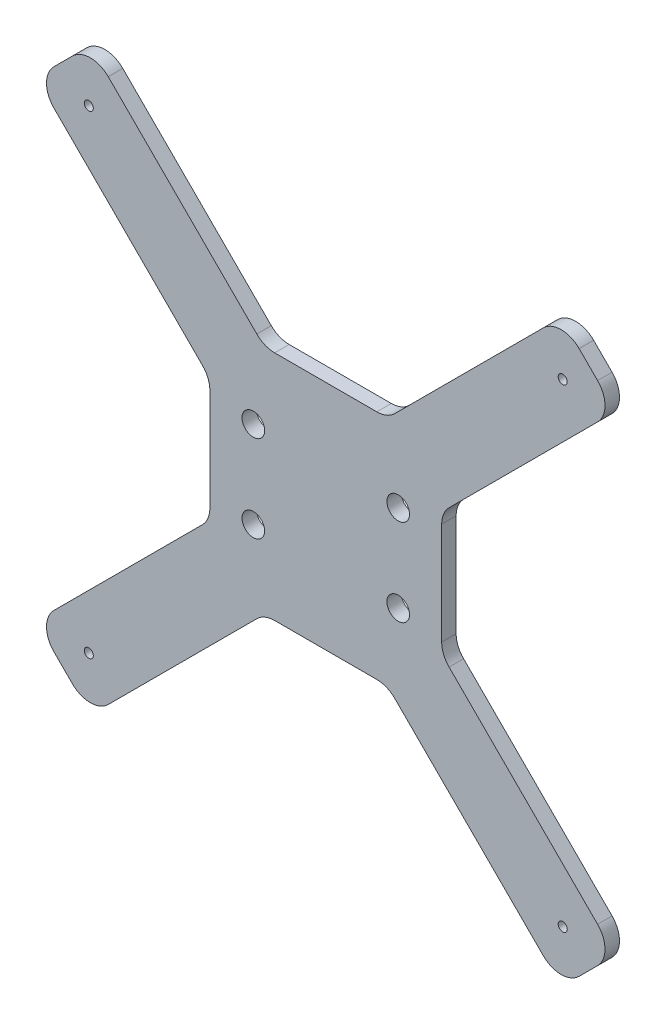
from build123d import *

# Parameters (mm, degrees)
BOSS_EXTRUDE1_DEPTH = 5.08
FILLET1_R           = 8.89
SKETCH2_R           = 3.96875
CUT_EXTRUDE1_DEPTH  = 283.206280731
SKETCH3_R           = 1.5875
CUT_EXTRUDE2_DEPTH  = 283.206280731


with BuildPart() as part:
    # Sketch1 → Boss-Extrude1 (new body)
    with BuildSketch(Plane.XY):
        Polygon((0, 184.15), (60.96, 123.19), (60.96, 80.01), (0, 19.05), (19.05, 0), (80.01, 60.96), (123.19, 60.96), (184.15, 0), (203.2, 19.05), (142.24, 80.01), (142.24, 123.19), (203.2, 184.15), (184.15, 203.2), (123.19, 142.24), (80.01, 142.24), (19.05, 203.2), align=None)
    extrude(amount=BOSS_EXTRUDE1_DEPTH)

    # Fillet1
    fillet1_edges = [part.edges().sort_by_distance(p)[0] for p in [
        (60.96, 80.01, 2.54),
        (60.96, 123.19, 2.54),
        (0, 184.15, 2.54),
        (19.05, 203.2, 2.54),
        (80.01, 142.24, 2.54),
        (123.19, 142.24, 2.54),
        (184.15, 203.2, 2.54),
        (203.2, 184.15, 2.54),
        (142.24, 123.19, 2.54),
        (142.24, 80.01, 2.54),
        (203.2, 19.05, 2.54),
        (184.15, 0, 2.54),
        (123.19, 60.96, 2.54),
        (80.01, 60.96, 2.54),
        (0, 19.05, 2.54),
        (19.05, 0, 2.54),
    ]]
    fillet(fillet1_edges, radius=FILLET1_R)

    # Sketch2 → Cut-Extrude1 (cut, through all)
    with BuildSketch(Plane.XY.offset(5.08)):
        with Locations((127, 86.36)):
            Circle(SKETCH2_R)
        with Locations((127, 116.84)):
            Circle(SKETCH2_R)
        with Locations((76.2, 86.36)):
            Circle(SKETCH2_R)
        with Locations((76.2, 116.84)):
            Circle(SKETCH2_R)
    extrude(amount=-CUT_EXTRUDE1_DEPTH, mode=Mode.SUBTRACT)

    # Sketch3 → Cut-Extrude2 (cut, through all)
    with BuildSketch(Plane.XY.offset(5.08)):
        with Locations((184.688815367, 184.700672391)):
            Circle(SKETCH3_R)
        with Locations((18.511184633, 184.700672391)):
            Circle(SKETCH3_R)
        with Locations((18.511184633, 18.499327609)):
            Circle(SKETCH3_R)
        with Locations((184.688815367, 18.499327609)):
            Circle(SKETCH3_R)
    extrude(amount=-CUT_EXTRUDE2_DEPTH, mode=Mode.SUBTRACT)


solid = part.part
